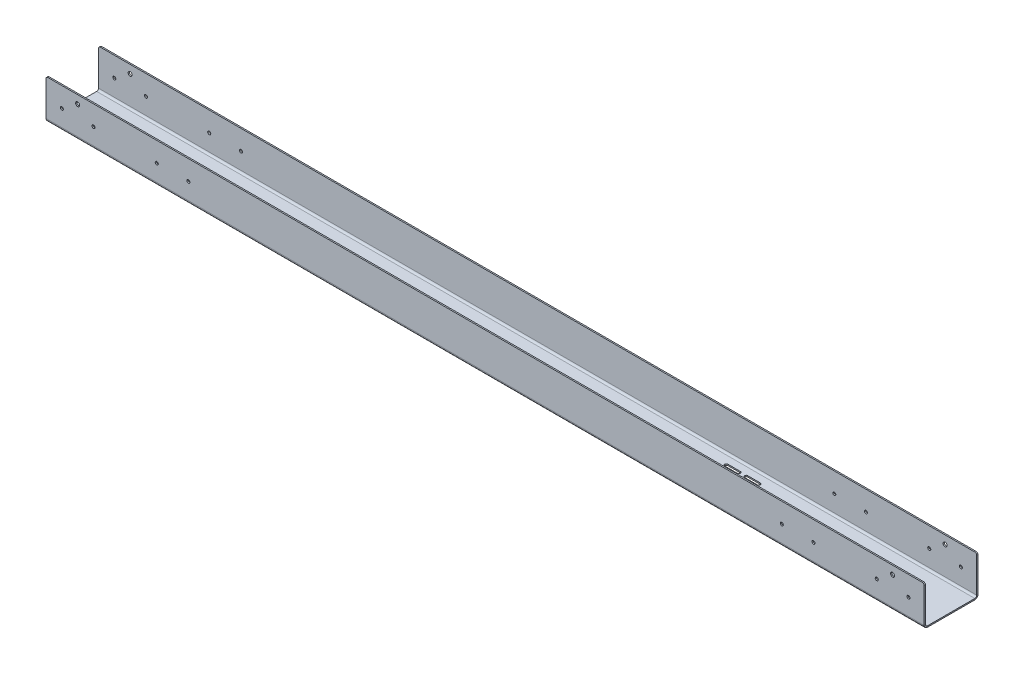
from build123d import *

# Parameters (mm, degrees)
SKETCH1_W                         = 1409.7
SKETCH1_H                         = 76.2
BASE_FLANGE1_DEPTH                = 2.052574
EDGE_FLANGE1_DEPTH                = 1409.7
EDGE_FLANGE1_BEND_DEPTH           = 1409.7
SKETCH12_W                        = 76.2
SKETCH12_H                        = 25.4
CUT_EXTRUDE1_DEPTH                = 1414.376049374
F_9_START                         = -2.052574
F_9_0_196_DIAMETER_SLOT1_DEPTH    = 2.052574
F_10_0_1935_DIAMETER_HOLE1_D      = 4.9149
SKETCH18_W                        = 3.2639
SKETCH18_H                        = 84.252574
F_0_257_DIAMETER_HOLE1_AT_2_COUNT = 2
F_0_257_DIAMETER_HOLE1_AT_2_PITCH = 1308.1
F_0_257_DIAMETER_HOLE2_D          = 6.5278
FILLET1_R                         = 3.175


# Read off the part's stored shape, not the designer's step: #9 (0.196) Diameter Slot1
# Sheet-metal steps are written as plain solids
with BuildPart() as part:
    # Sketch1 → Base-Flange1 (new body)
    with BuildSketch(Plane(origin=(0, 0, 0), x_dir=(1, 0, 0), z_dir=(0, 1, 0))):
        with Locations((704.85, 38.1)):
            Rectangle(SKETCH1_W, SKETCH1_H)
    extrude(amount=-BASE_FLANGE1_DEPTH)

    # Edge-Flange1 section (across the edge) → Edge-Flange1 (add)
    with BuildSketch(Plane(origin=(0, 0, 3), x_dir=(0, 0, -1), z_dir=(1, 0, 0))):
        with BuildLine():
            Line((-2.052574, 3), (-2.052574, 61.447426))
            Line((-2.052574, 61.447426), (0, 61.447426))
            Line((0, 61.447426), (0, 3))
            ThreePointArc((0, 3), (0.878679656, 0.878679656), (3, 0))
            Line((3, 0), (3, -2.052574))
            ThreePointArc((3, -2.052574), (-0.572709338, -0.572709338), (-2.052574, 3))
        make_face()
    extrude(amount=EDGE_FLANGE1_DEPTH)

    # Edge-Flange1 section 2 (across the edge) → Edge-Flange1 bend (add)
    with BuildSketch(Plane(origin=(1409.7, 0, -79.2), x_dir=(0, 0, 1), z_dir=(-1, 0, 0))):
        with BuildLine():
            Line((-2.052574, 3), (-2.052574, 61.447426))
            Line((-2.052574, 61.447426), (0, 61.447426))
            Line((0, 61.447426), (0, 3))
            ThreePointArc((0, 3), (0.878679656, 0.878679656), (3, 0))
            Line((3, 0), (3, -2.052574))
            ThreePointArc((3, -2.052574), (-0.572709338, -0.572709338), (-2.052574, 3))
        make_face()
    extrude(amount=EDGE_FLANGE1_BEND_DEPTH)

    # Sketch12 → Cut-Extrude1 (cut, through all)
    with BuildSketch(Plane(origin=(0, 0, 0), x_dir=(1, 0, 0), z_dir=(0, 1, 0))):
        with Locations((1041.4, 38.1)):
            Rectangle(SKETCH12_W, SKETCH12_H)
    extrude(amount=-CUT_EXTRUDE1_DEPTH, mode=Mode.SUBTRACT)

    # #9 (0.196) Diameter Slot1 outline → #9 (0.196) Diameter Slot1 (cut)
    with BuildSketch(Plane(origin=(0, 0, 0), x_dir=(1, 0, 0), z_dir=(0, 1, 0)).offset(F_9_START)):
        with BuildLine():
            Line((1024.843257889, 59.59668), (1045.264857889, 59.59668))
            ThreePointArc((1045.264857889, 59.59668), (1047.754057889, 62.08588), (1045.264857889, 64.57508))
            Line((1045.264857889, 64.57508), (1024.843257889, 64.57508))
            ThreePointArc((1024.843257889, 64.57508), (1022.354057889, 62.08588), (1024.843257889, 59.59668))
        make_face()
        with BuildLine():
            ThreePointArc((1077.0108, 59.59668), (1079.5, 62.08588), (1077.0108, 64.57508))
            Line((1077.0108, 64.57508), (1056.5892, 64.57508))
            ThreePointArc((1056.5892, 64.57508), (1054.1, 62.08588), (1056.5892, 59.59668))
            Line((1056.5892, 59.59668), (1077.0108, 59.59668))
        make_face()
        with BuildLine():
            Line((1024.843257889, 11.117318322), (1045.264857889, 11.117318322))
            ThreePointArc((1045.264857889, 11.117318322), (1047.754057889, 13.606518322), (1045.264857889, 16.095718322))
            Line((1045.264857889, 16.095718322), (1024.843257889, 16.095718322))
            ThreePointArc((1024.843257889, 16.095718322), (1022.354057889, 13.606518322), (1024.843257889, 11.117318322))
        make_face()
        with BuildLine():
            Line((1056.5892, 11.62492), (1077.0108, 11.62492))
            ThreePointArc((1077.0108, 11.62492), (1079.5, 14.11412), (1077.0108, 16.60332))
            Line((1077.0108, 16.60332), (1056.5892, 16.60332))
            ThreePointArc((1056.5892, 16.60332), (1054.1, 14.11412), (1056.5892, 11.62492))
        make_face()
    extrude(amount=F_9_0_196_DIAMETER_SLOT1_DEPTH, mode=Mode.SUBTRACT)

    # #10 (0.1935) Diameter Hole1 (through all)
    with Locations(Plane(origin=(0, 0, -81.252574), x_dir=(-1, 0, 0), z_dir=(0, 0, -1))):
        with Locations((-1384.3, 29.697426), (-1333.5, 29.697426), (-1231.9, 29.697426), (-1181.1, 29.697426), (-228.6, 29.697426), (-177.8, 29.697426), (-76.2, 29.697426), (-25.4, 29.697426)):
            Hole(F_10_0_1935_DIAMETER_HOLE1_D / 2)

    # Sketch18 → F (0.257) Diameter Hole1 (revolve, cut)
    with BuildSketch(Plane(origin=(1358.9, 48.229266, -79.2), x_dir=(0, 1, 0), z_dir=(1, 0, 0))):
        with Locations((1.63195, 42.126287)):
            Rectangle(SKETCH18_W, SKETCH18_H)
    f_0_257_diameter_hole1 = revolve(axis=Axis((1358.9, 48.229266, -85.55), (0, 0, 1)), mode=Mode.SUBTRACT)

    # F (0.257) Diameter Hole1 at 2: F (0.257) Diameter Hole1 ×2
    with Locations(*[(-i * F_0_257_DIAMETER_HOLE1_AT_2_PITCH, 0, 0) for i in range(1, F_0_257_DIAMETER_HOLE1_AT_2_COUNT)]):
        add(f_0_257_diameter_hole1, mode=Mode.SUBTRACT)

    # F (0.257) Diameter Hole2 (through all)
    with Locations(Plane.XY.offset(-79.2)):
        with Locations((50.8, 48.229266), (1358.9, 48.229266)):
            Hole(F_0_257_DIAMETER_HOLE2_D / 2)

    # Fillet1
    fillet1_edges = [part.edges().sort_by_distance(p)[0] for p in [
        (0, 61.447426, 4.026287),
        (1409.7, 61.447426, 4.026287),
        (1409.7, 61.447426, -80.226287),
        (0, 61.447426, -80.226287),
    ]]
    fillet(fillet1_edges, radius=FILLET1_R)


solid = part.part
